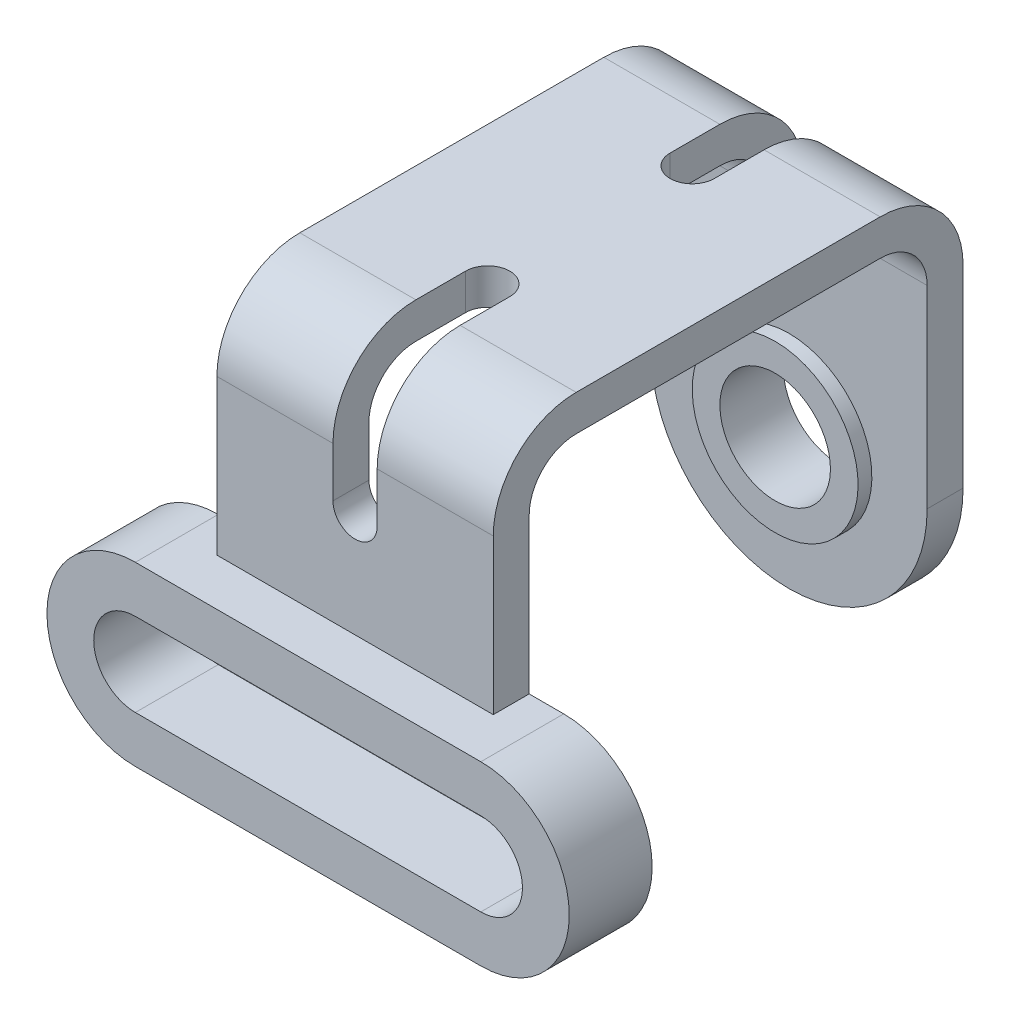
from build123d import *

# Parameters (mm, degrees)
BOSS_EXTRUDE1_DEPTH      = 100
FILLET1_R                = 30
FILLET2_R                = 17
BOSS_EXTRUDE2_DEPTH      = 17
BOSS_EXTRUDE2_DEPTH_BACK = 13
CUT_EXTRUDE1_START       = -17
SKETCH2_4_W              = 100
SKETCH2_4_H              = 30.125527048
CUT_EXTRUDE1_DEPTH       = 17
FILLET3_R                = 50
BOSS_EXTRUDE3_DEPTH      = 5
BOSS_EXTRUDE3_DEPTH_BACK = 18
SKETCH3_R                = 30
SKETCH3_R_2              = 20
SKETCH3_2_R              = 20
CUT_EXTRUDE2_DEPTH       = 25
CUT_EXTRUDE3_DEPTH       = 25
CUT_EXTRUDE4_DEPTH       = 25
CUT_EXTRUDE5_START       = -25
CUT_EXTRUDE5_DEPTH       = 25


with BuildPart() as part:
    # Sketch1 → Boss-Extrude1 (new body)
    with BuildSketch(Plane(origin=(0, 0, 0), x_dir=(0, 0, -1), z_dir=(1, 0, 0))):
        Polygon((0, 0), (0, 137), (144, 137), (144, 0), (157, 0), (157, 150), (-13, 150), (-13, 0), align=None)
    extrude(amount=BOSS_EXTRUDE1_DEPTH)

    # Fillet1
    fillet1_edges = [part.edges().sort_by_distance(p)[0] for p in [
        (50, 150, -157),
        (50, 150, 13),
    ]]
    fillet(fillet1_edges, radius=FILLET1_R)

    # Fillet2
    fillet2_edges = [part.edges().sort_by_distance(p)[0] for p in [
        (50, 137, 0),
        (50, 137, -144),
    ]]
    fillet(fillet2_edges, radius=FILLET2_R)

    # Sketch2 → Boss-Extrude2 (add, two sides: drawn at the far end of the back side and taken through both)
    with BuildSketch(Plane.XY.offset(13).offset(-BOSS_EXTRUDE2_DEPTH_BACK)):
        with BuildLine():
            Line((-12.5, 64), (112.5, 64))
            ThreePointArc((112.5, 64), (144.5, 32), (112.5, 0))
            Line((112.5, 0), (-12.5, 0))
            ThreePointArc((-12.5, 0), (-44.5, 32), (-12.5, 64))
        make_face()
        with BuildLine():
            Line((-12.5, 47.062763524), (112.5, 47.062763524))
            ThreePointArc((112.5, 47.062763524), (127.562763524, 32), (112.5, 16.937236476))
            Line((112.5, 16.937236476), (-12.5, 16.937236476))
            ThreePointArc((-12.5, 16.937236476), (-27.562763524, 32), (-12.5, 47.062763524))
        make_face(mode=Mode.SUBTRACT)
    extrude(amount=BOSS_EXTRUDE2_DEPTH + BOSS_EXTRUDE2_DEPTH_BACK)

    # Sketch2<4> → Cut-Extrude1 (cut)
    with BuildSketch(Plane.XY.offset(13).offset(CUT_EXTRUDE1_START)):
        with BuildLine():
            Line((0, 16.937236476), (0, 47.062763524))
            Line((0, 47.062763524), (-12.5, 47.062763524))
            ThreePointArc((-12.5, 47.062763524), (-27.562763524, 32), (-12.5, 16.937236476))
            Line((-12.5, 16.937236476), (0, 16.937236476))
        make_face()
        with Locations((50, 32)):
            Rectangle(SKETCH2_4_W, SKETCH2_4_H)
        with BuildLine():
            Line((112.5, 47.062763524), (100, 47.062763524))
            Line((100, 47.062763524), (100, 16.937236476))
            Line((100, 16.937236476), (112.5, 16.937236476))
            ThreePointArc((112.5, 16.937236476), (127.562763524, 32), (112.5, 47.062763524))
        make_face()
    extrude(amount=CUT_EXTRUDE1_DEPTH, mode=Mode.SUBTRACT)

    # Fillet3
    fillet3_edges = [part.edges().sort_by_distance(p)[0] for p in [
        (0, 0, -150.5),
        (100, 0, -150.5),
    ]]
    fillet(fillet3_edges, radius=FILLET3_R - 0.0001)  # a hair under: the kernel refuses the full size

    # Sketch3 → Boss-Extrude3 (add, two sides: drawn at the far end of the back side and taken through both)
    with BuildSketch(Plane(origin=(0, 0, -157), x_dir=(-1, 0, 0), z_dir=(0, 0, -1)).offset(-BOSS_EXTRUDE3_DEPTH_BACK)):
        with Locations(Location((-50, 50, 0), (0, 0, 90))):
            Circle(SKETCH3_R)
        with Locations(Location((-50, 50, 0), (0, 0, 90))):
            Circle(SKETCH3_R_2, mode=Mode.SUBTRACT)
    extrude(amount=BOSS_EXTRUDE3_DEPTH + BOSS_EXTRUDE3_DEPTH_BACK)

    # Sketch3<2> → Cut-Extrude2 (cut)
    with BuildSketch(Plane(origin=(0, 0, -157), x_dir=(-1, 0, 0), z_dir=(0, 0, -1))):
        with Locations(Location((-50, 50, 0), (0, 0, 90))):
            Circle(SKETCH3_2_R)
    extrude(amount=-CUT_EXTRUDE2_DEPTH, mode=Mode.SUBTRACT)

    # Sketch4 → Cut-Extrude3 (cut)
    with BuildSketch(Plane(origin=(0, 0, -157), x_dir=(-1, 0, 0), z_dir=(0, 0, -1))):
        with BuildLine():
            Line((-58, 150), (-58, 102))
            ThreePointArc((-58, 102), (-50, 94), (-42, 102))
            Line((-42, 102), (-42, 150))
            ThreePointArc((-42, 150), (-50, 158), (-58, 150))
        make_face()
    extrude(amount=-CUT_EXTRUDE3_DEPTH, mode=Mode.SUBTRACT)

    # Sketch5 → Cut-Extrude4 (cut)
    with BuildSketch(Plane(origin=(0, 150, 0), x_dir=(1, 0, 0), z_dir=(0, 1, 0))):
        with BuildLine():
            Line((58, 157), (58, 109))
            ThreePointArc((58, 109), (50, 101), (42, 109))
            Line((42, 109), (42, 157))
            ThreePointArc((42, 157), (50, 165), (58, 157))
        make_face()
        with BuildLine():
            Line((42, -13), (42, 35))
            ThreePointArc((42, 35), (50, 43), (58, 35))
            Line((58, 35), (58, -13))
            ThreePointArc((58, -13), (50, -21), (42, -13))
        make_face()
    extrude(amount=-CUT_EXTRUDE4_DEPTH, mode=Mode.SUBTRACT)

    # Sketch6 → Cut-Extrude5 (cut)
    with BuildSketch(Plane.XY.offset(13).offset(CUT_EXTRUDE5_START)):
        with BuildLine():
            Line((58, 150), (58, 102))
            ThreePointArc((58, 102), (50, 94), (42, 102))
            Line((42, 102), (42, 150))
            ThreePointArc((42, 150), (50, 158), (58, 150))
        make_face()
    extrude(amount=CUT_EXTRUDE5_DEPTH, mode=Mode.SUBTRACT)


solid = part.part
